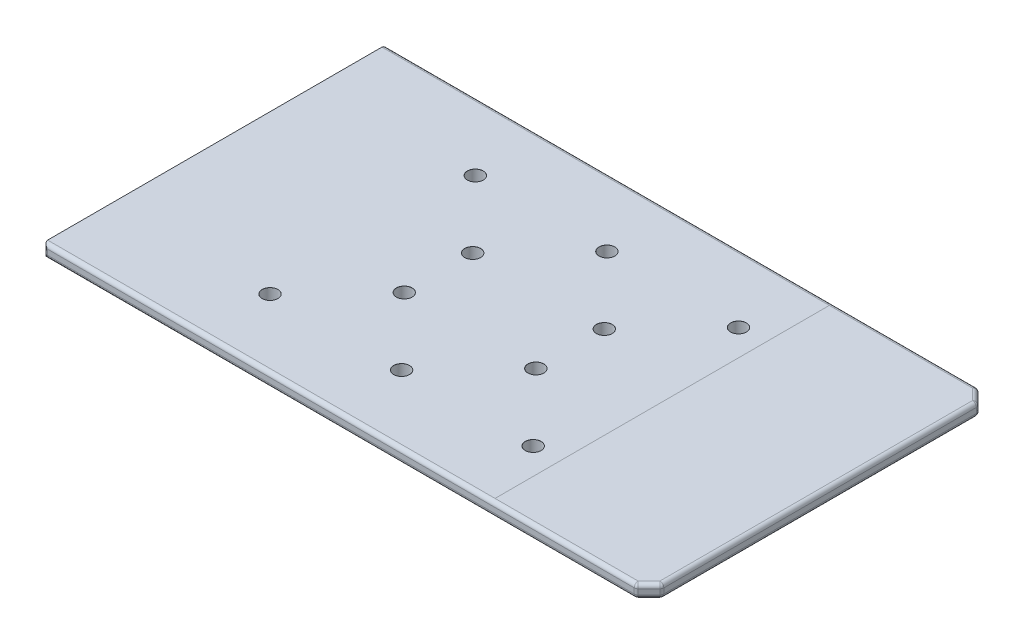
from build123d import *

# Parameters (mm, degrees)
SKETCH1_W                       = 460
SKETCH1_H                       = 260
BASE_FLANGE1_DEPTH              = 10
BREAK_CORNER1_DEPTH             = 10
M10_CLEARANCE_HOLE1_D           = 12
M10_CLEARANCE_HOLE1_CSINK_D     = 12.05
M10_CLEARANCE_HOLE1_CSINK_ANGLE = 90
FILLET1_R                       = 3


# Read off the part's stored shape, not the designer's step: Break-Corner1
# Sheet-metal steps are written as plain solids
with BuildPart() as part:
    # Sketch1 → Base-Flange1 (new body)
    with BuildSketch(Plane(origin=(0, 0, 0), x_dir=(1, 0, 0), z_dir=(0, 1, 0))):
        Rectangle(SKETCH1_W, SKETCH1_H)
    extrude(amount=BASE_FLANGE1_DEPTH)

    # Break-Corner1 outline → Break-Corner1 (cut)
    with BuildSketch(Plane(origin=(0, 0, 0), x_dir=(1, 0, 0), z_dir=(0, 1, 0))):
        Polygon((230, -130), (230, -120), (220, -130), align=None)
        Polygon((220, 130), (230, 120), (230, 130), align=None)
    extrude(amount=BREAK_CORNER1_DEPTH, mode=Mode.SUBTRACT)

    # M10 Clearance Hole1 (through all)
    with Locations(Plane(origin=(0, 10, 0), x_dir=(1, 0, 0), z_dir=(0, 1, 0))):
        with Locations((-110, 78), (-10, 78), (90, 78), (-60, 26), (40, 26), (-60, -26), (40, -26), (-110, -78), (-10, -78), (90, -78)):
            CounterSinkHole(M10_CLEARANCE_HOLE1_D / 2, M10_CLEARANCE_HOLE1_CSINK_D / 2, counter_sink_angle=M10_CLEARANCE_HOLE1_CSINK_ANGLE)

    # Fillet1
    fillet1_edges = [part.edges().sort_by_distance(p)[0] for p in [
        (230, 0, 0),
        (230, 10, 0),
        (230, 5, 120),
        (225, 0, 125),
        (220, 5, 130),
        (225, 10, 125),
        (-5, 0, -130),
        (-5, 10, -130),
        (220, 5, -130),
        (225, 0, -125),
        (230, 5, -120),
        (225, 10, -125),
        (-5, 0, 130),
        (-230, 5, -130),
        (-230, 5, 130),
        (-5, 10, 130),
    ]]
    fillet(fillet1_edges, radius=FILLET1_R)


solid = part.part
